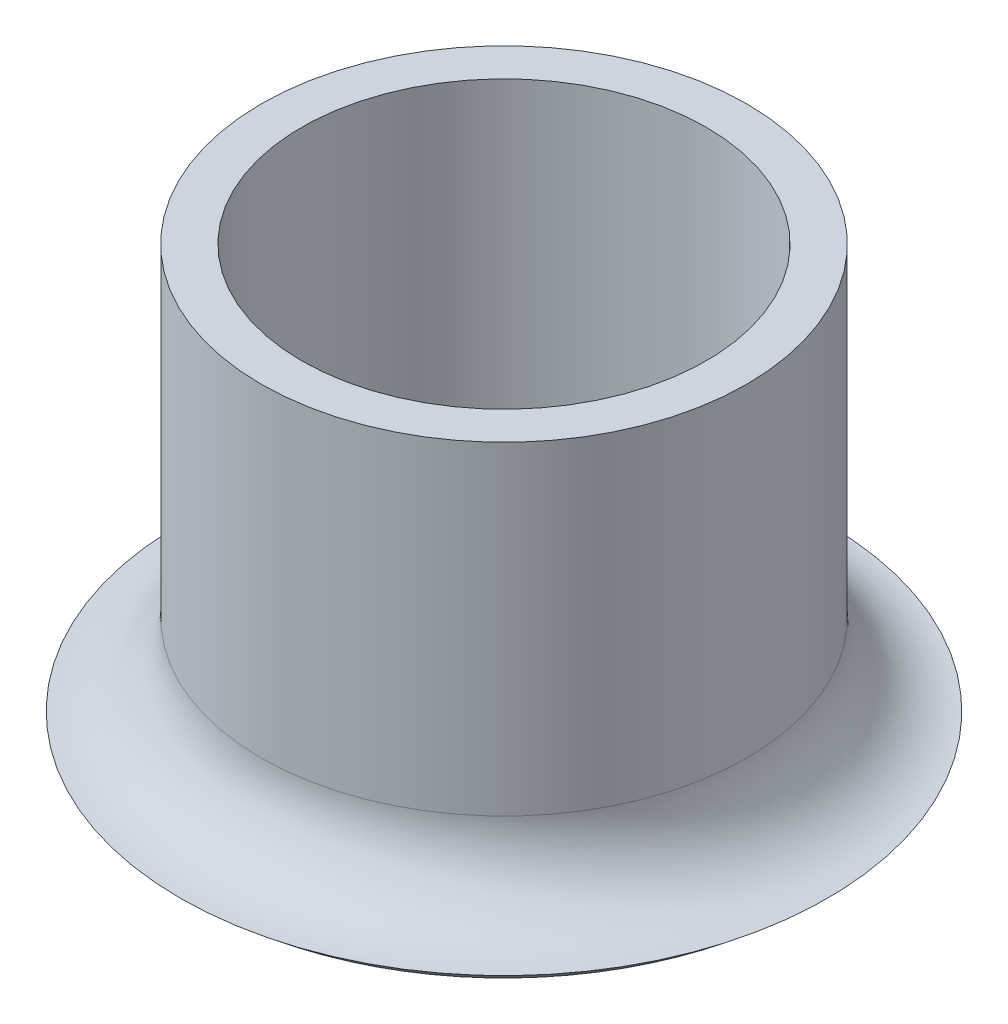
from build123d import *

# Parameters (mm, degrees)
SKETCH1_R           = 3
BOSS_EXTRUDE1_DEPTH = 5
SKETCH2_R           = 2.5
CUT_EXTRUDE1_DEPTH  = 4
SKETCH3_R           = 4
BOSS_EXTRUDE3_DEPTH = 1
FILLET2_R           = 1
FILLET3_R           = 4


# Some blends are built 0.0001 mm under size
with BuildPart() as part:
    # Sketch1 → Boss-Extrude1 (new body)
    with BuildSketch(Plane(origin=(0, 0, 0), x_dir=(1, 0, 0), z_dir=(0, 1, 0))):
        with Locations(Location((0, 0, 0), (0, 0, 270))):
            Circle(SKETCH1_R)
    extrude(amount=BOSS_EXTRUDE1_DEPTH)

    # Sketch2 → Cut-Extrude1 (cut)
    with BuildSketch(Plane(origin=(0, 5, 0), x_dir=(1, 0, 0), z_dir=(0, 1, 0))):
        with Locations(Location((0, 0, 0), (0, 0, 270))):
            Circle(SKETCH2_R)
    extrude(amount=-CUT_EXTRUDE1_DEPTH, mode=Mode.SUBTRACT)

    # Sketch3 → Boss-Extrude3 (add)
    with BuildSketch(Plane.XZ):
        with Locations(Location((0, 0, 0), (0, 0, 270))):
            Circle(SKETCH3_R)
    extrude(amount=BOSS_EXTRUDE3_DEPTH)

    # Fillet2
    fillet2_edges = [part.edges().sort_by_distance(p)[0] for p in [
        (0, 0, -3),
    ]]
    fillet(fillet2_edges, radius=FILLET2_R - 0.0001)  # a hair under: the kernel refuses the full size

    # Fillet3
    # the kernel refuses this fillet: 4 mm, written as the material it takes off along each edge
    with BuildSketch(Plane(origin=(0, -1, 0), x_dir=(0, 0, -1), z_dir=(-1, 0, 0))) as fillet3_piece_1:
        with BuildLine():
            CenterArc((1.354248689, -4), FILLET3_R, 48.590377891, 41.409622109)
            Line((1.354248689, 0), (1.354248689, 0.08))
            Line((1.354248689, 0.08), (4, 0.08))
            Line((4, 0.08), (4.08, 0))
            ThreePointArc((4.08, 0), (4.08, -0.5), (4.052915026, -0.94))
            Line((4.052915026, -0.94), (4, -1))
        make_face()
    revolve(axis=Axis((0, -1, 0), (0, -1, 0)), mode=Mode.SUBTRACT)


solid = part.part
